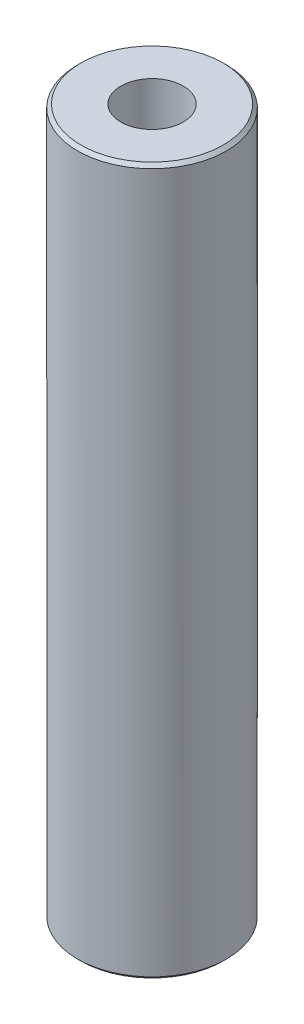
from build123d import *

# Parameters (mm, degrees)
SKETCH1_R           = 10
BOSS_EXTRUDE1_DEPTH = 94.835635642
SKETCH2_R           = 4.188586336
CUT_EXTRUDE1_DEPTH  = 96.884293748
CHAMFER1_SIZE       = 0.4504304


with BuildPart() as part:
    # Sketch1 → Boss-Extrude1 (new body)
    with BuildSketch(Plane(origin=(0, 0, 0), x_dir=(1, 0, 0), z_dir=(0, 1, 0))):
        Circle(SKETCH1_R)
    extrude(amount=BOSS_EXTRUDE1_DEPTH)

    # Sketch2 → Cut-Extrude1 (cut, through all)
    with BuildSketch(Plane(origin=(0, 0, 0), x_dir=(1, 0, 0), z_dir=(0, 1, 0))):
        Circle(SKETCH2_R)
    extrude(amount=CUT_EXTRUDE1_DEPTH, mode=Mode.SUBTRACT)

    # Chamfer1
    chamfer1_edges = [part.edges().sort_by_distance(p)[0] for p in [
        (-10, 94.835635642, 0),
        (-10, 0, 0),
    ]]
    chamfer(chamfer1_edges, length=CHAMFER1_SIZE)


solid = part.part
